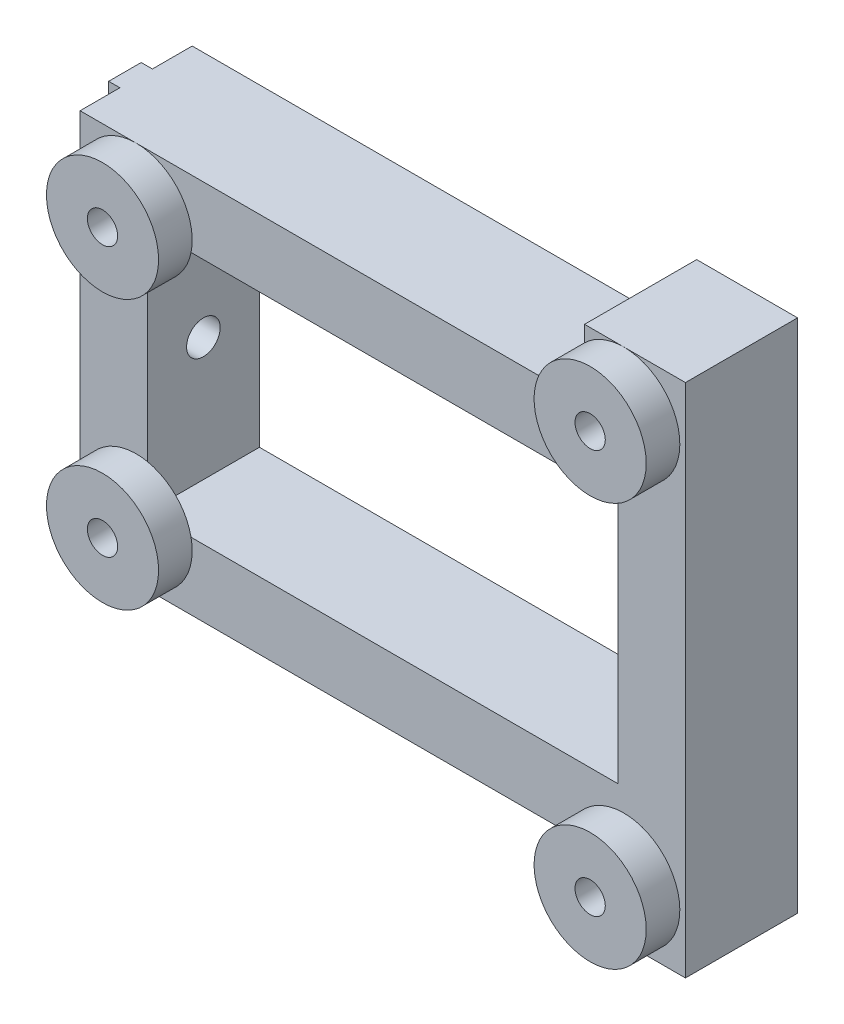
from build123d import *

# Parameters (mm, degrees)
ESQUISSE1_W             = 54
ESQUISSE1_H             = 46
BOSS_EXTRU_1_DEPTH      = 10
ESQUISSE2_R             = 1.35
ENL_V_MAT_EXTRU_1_DEPTH = 37.851051545
ESQUISSE3_R             = 5
BOSS_EXTRU_2_DEPTH      = 3
ESQUISSE4_W             = 45
ESQUISSE4_H             = 10
ENL_V_MAT_EXTRU_2_DEPTH = 6
ESQUISSE6_W             = 45
ESQUISSE6_H             = 10
ENL_V_MAT_EXTRU_3_DEPTH = 6
ESQUISSE7_W             = 2.9
ESQUISSE7_H             = 34
BOSS_EXTRU_3_DEPTH      = 1
ESQUISSE10_W            = 42
ESQUISSE10_H            = 22
ENL_V_MAT_EXTRU_5_DEPTH = 38.589892258
ENL_V_MAT_EXTRU_4_REACH = 63.016
ESQUISSE8_R             = 1.5
ESQUISSE11_R            = 1.35
ENL_V_MAT_EXTRU_6_DEPTH = 38.589892258


with BuildPart() as part:
    # Esquisse1 → Boss.-Extru.1 (new body)
    with BuildSketch(Plane.XY):
        Rectangle(ESQUISSE1_W, ESQUISSE1_H)
    extrude(amount=BOSS_EXTRU_1_DEPTH)

    # Esquisse2 → Enlèv. mat.-Extru.1 (cut, through all)
    with BuildSketch(Plane.XY.offset(10)):
        with Locations((-22, -12)):
            Circle(ESQUISSE2_R)
        with Locations((-22, 12)):
            Circle(ESQUISSE2_R)
        with Locations((21.5, 18)):
            Circle(ESQUISSE2_R)
        with Locations((21.5, -18)):
            Circle(ESQUISSE2_R)
    extrude(amount=-ENL_V_MAT_EXTRU_1_DEPTH, mode=Mode.SUBTRACT)

    # Esquisse3 → Boss.-Extru.2 (add)
    with BuildSketch(Plane.XY.offset(10)):
        with Locations((-22, 12)):
            Circle(ESQUISSE3_R)
        with Locations((-22, -12)):
            Circle(ESQUISSE3_R)
        with Locations((21.5, -18)):
            Circle(ESQUISSE3_R)
        with Locations((21.5, 18)):
            Circle(ESQUISSE3_R)
    extrude(amount=BOSS_EXTRU_2_DEPTH)

    # Esquisse4 → Enlèv. mat.-Extru.2 (cut)
    with BuildSketch(Plane.XZ.offset(23)):
        with Locations((-4.5, 5)):
            Rectangle(ESQUISSE4_W, ESQUISSE4_H)
    extrude(amount=-ENL_V_MAT_EXTRU_2_DEPTH, mode=Mode.SUBTRACT)

    # Esquisse6 → Enlèv. mat.-Extru.3 (cut)
    with BuildSketch(Plane(origin=(0, 23, 0), x_dir=(1, 0, 0), z_dir=(0, 1, 0))):
        with Locations((-4.5, -5)):
            Rectangle(ESQUISSE6_W, ESQUISSE6_H)
    extrude(amount=-ENL_V_MAT_EXTRU_3_DEPTH, mode=Mode.SUBTRACT)

    # Esquisse7 → Boss.-Extru.3 (add)
    with BuildSketch(Plane.ZY.offset(27)):
        with Locations((5, 0)):
            Rectangle(ESQUISSE7_W, ESQUISSE7_H)
    extrude(amount=BOSS_EXTRU_3_DEPTH)

    # Esquisse10 → Enlèv. mat.-Extru.5 (cut, through all)
    with BuildSketch(Plane.XY.offset(10)):
        Rectangle(ESQUISSE10_W, ESQUISSE10_H)
    extrude(amount=-ENL_V_MAT_EXTRU_5_DEPTH, mode=Mode.SUBTRACT)

    # Esquisse8 → Enlèv. mat.-Extru.4 (cut, up to next)
    with BuildSketch(Plane.ZY.offset(28), mode=Mode.PRIVATE) as enl_v_mat_extru_4_sk1:
        with Locations((5, 0)):
            Circle(ESQUISSE8_R)
    enl_v_mat_extru_4_tool1 = extrude(enl_v_mat_extru_4_sk1.sketch, amount=-ENL_V_MAT_EXTRU_4_REACH, mode=Mode.PRIVATE) & part.part
    add(enl_v_mat_extru_4_tool1.solids().sort_by_distance((-28, 0, 5))[0], mode=Mode.SUBTRACT)

    # Esquisse11 → Enlèv. mat.-Extru.6 (cut, through all)
    with BuildSketch(Plane(origin=(0, 0, 10), x_dir=(-1, 0, 0), z_dir=(0, 0, -1))):
        with Locations((-21.5, 18)):
            Circle(ESQUISSE11_R)
        with Locations((22, 12)):
            Circle(ESQUISSE11_R)
        with Locations((22, -12)):
            Circle(ESQUISSE11_R)
        with Locations((-21.5, -18)):
            Circle(ESQUISSE11_R)
    extrude(amount=-ENL_V_MAT_EXTRU_6_DEPTH, mode=Mode.SUBTRACT)


solid = part.part
